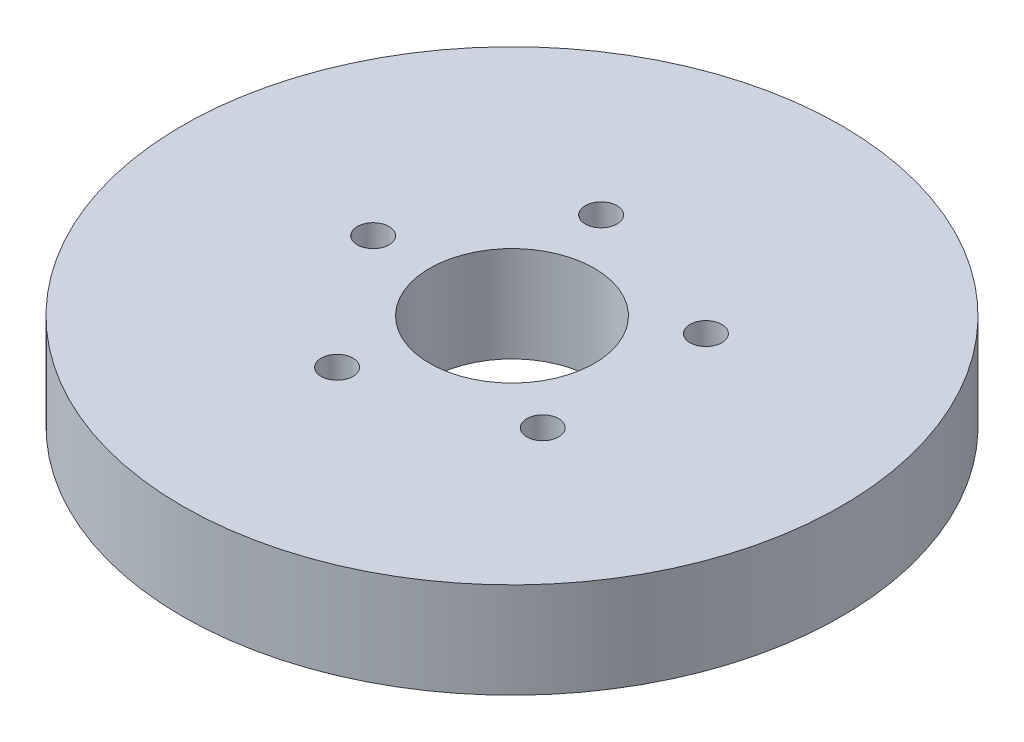
from build123d import *

# Parameters (mm, degrees)
SKETCH1_R           = 100
BOSS_EXTRUDE1_DEPTH = 29
SKETCH2_R           = 25
CUT_EXTRUDE1_DEPTH  = 145.364122967
SKETCH3_R           = 4.82524539
CUT_EXTRUDE2_DEPTH  = 17.90129256
CIRPATTERN1_COUNT   = 5


with BuildPart() as part:
    # Sketch1 → Boss-Extrude1 (new body)
    with BuildSketch(Plane(origin=(0, 0, 0), x_dir=(1, 0, 0), z_dir=(0, 1, 0))):
        Circle(SKETCH1_R)
    extrude(amount=BOSS_EXTRUDE1_DEPTH)

    # Sketch2 → Cut-Extrude1 (cut, through all)
    with BuildSketch(Plane(origin=(0, 0, 0), x_dir=(1, 0, 0), z_dir=(0, 1, 0))):
        Circle(SKETCH2_R)
    extrude(amount=CUT_EXTRUDE1_DEPTH, mode=Mode.SUBTRACT)

    # Sketch3 → Cut-Extrude2 (cut)
    with BuildSketch(Plane(origin=(0, 29, 0), x_dir=(1, 0, 0), z_dir=(0, 1, 0))):
        with Locations((-42.123633246, 0)):
            Circle(SKETCH3_R)
    cut_extrude2 = extrude(amount=-CUT_EXTRUDE2_DEPTH, mode=Mode.SUBTRACT)

    # CirPattern1: Cut-Extrude2 ×5 about axis
    cirpattern1_axis = Axis((0, 0, 0), (0, 1, 0))
    for i in range(1, CIRPATTERN1_COUNT):
        add(cut_extrude2.rotate(cirpattern1_axis, i * 360 / CIRPATTERN1_COUNT), mode=Mode.SUBTRACT)


solid = part.part
